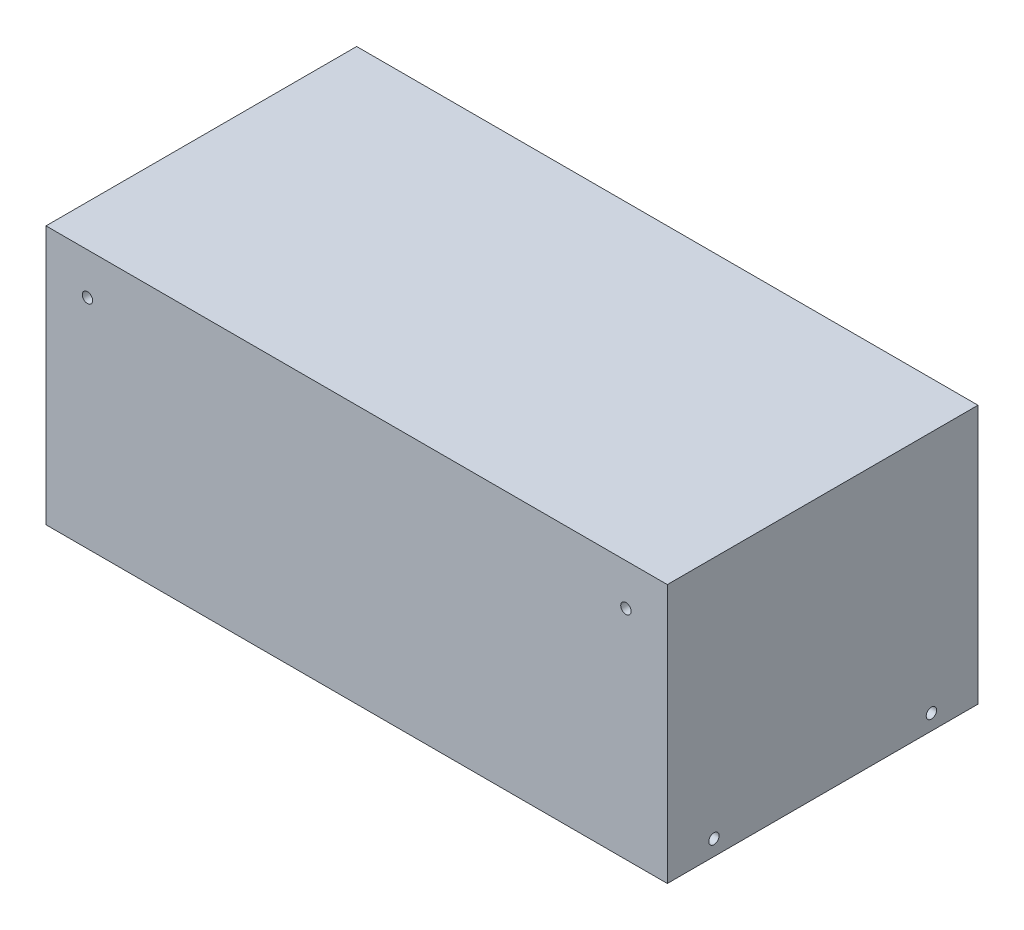
from build123d import *

# Parameters (mm, degrees)
SKETCH1_W           = 300
SKETCH1_H           = 150
BOSS_EXTRUDE1_DEPTH = 125
SKETCH2_W           = 270
SKETCH2_H           = 120
CUT_EXTRUDE1_DEPTH  = 110
SKETCH4_R           = 2.5
CUT_EXTRUDE5_DEPTH  = 350
SKETCH6_R           = 2.5
CUT_EXTRUDE6_DEPTH  = 175


with BuildPart() as part:
    # Sketch1 → Boss-Extrude1 (new body)
    with BuildSketch(Plane(origin=(0, 0, 0), x_dir=(1, 0, 0), z_dir=(0, 1, 0))):
        Rectangle(SKETCH1_W, SKETCH1_H)
    extrude(amount=BOSS_EXTRUDE1_DEPTH)

    # Sketch2 → Cut-Extrude1 (cut)
    with BuildSketch(Plane.XZ):
        Rectangle(SKETCH2_W, SKETCH2_H)
    extrude(amount=-CUT_EXTRUDE1_DEPTH, mode=Mode.SUBTRACT)

    # Sketch4 → Cut-Extrude5 (cut)
    with BuildSketch(Plane(origin=(150, 0, 0), x_dir=(0, 0, -1), z_dir=(1, 0, 0))):
        with Locations((-52.5, 7.5)):
            Circle(SKETCH4_R)
        with Locations((52.5, 7.5)):
            Circle(SKETCH4_R)
    extrude(amount=-CUT_EXTRUDE5_DEPTH, mode=Mode.SUBTRACT)

    # Sketch6 → Cut-Extrude6 (cut)
    with BuildSketch(Plane.XY.offset(75)):
        with Locations((-130, 105)):
            Circle(SKETCH6_R)
        with Locations((130, 105)):
            Circle(SKETCH6_R)
    extrude(amount=-CUT_EXTRUDE6_DEPTH, mode=Mode.SUBTRACT)


solid = part.part
